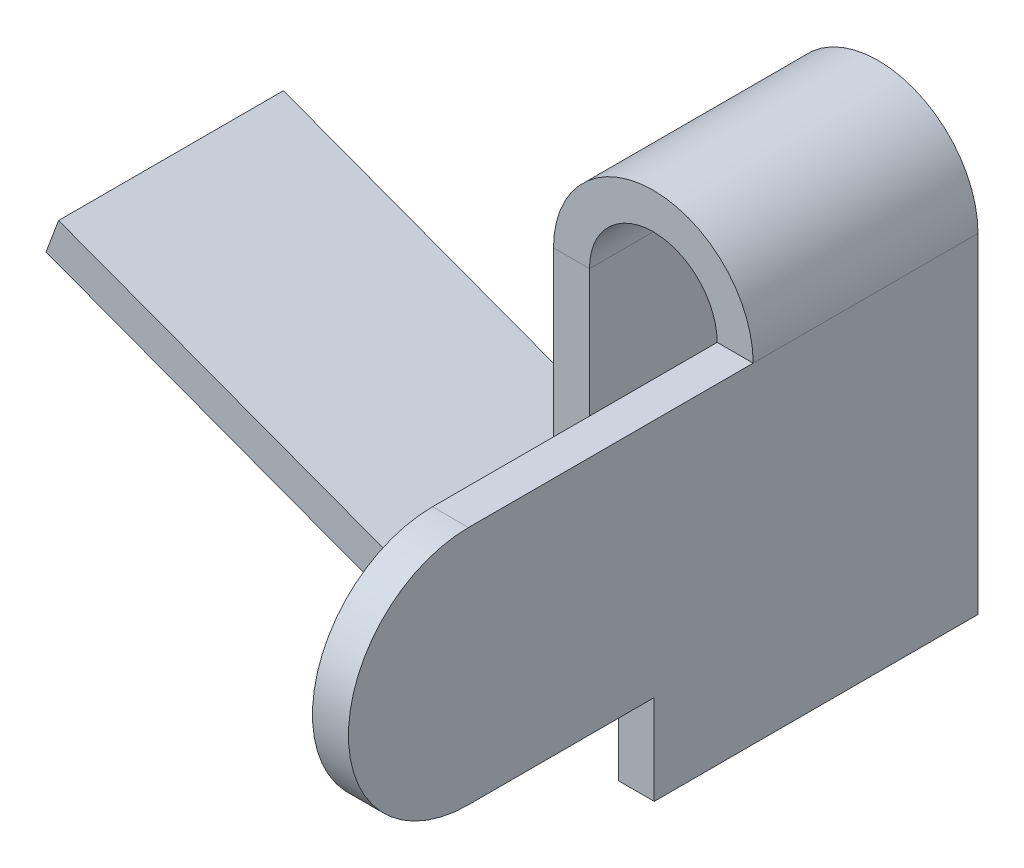
from build123d import *

# Parameters (mm, degrees)
BASE_FLANGE1_DEPTH  = 2.5
SKETCH8_W           = 0.4
SKETCH8_H           = 3.67
BOSS_EXTRUDE1_DEPTH = 4.5
SKETCH9_W           = 3.4
SKETCH9_H           = 1
CUT_EXTRUDE1_DEPTH  = 11.945052861
FILLET1_RADIUS      = 1.335
FILLET1_LENGTH      = 0.4


# Sheet-metal steps are written as plain solids
with BuildPart() as part:
    # Sketch3 → Base-Flange1 (new body)
    with BuildSketch(Plane.XY):
        with BuildLine():
            Line((0.71, -1.835), (0.71, 1.835))
            ThreePointArc((0.71, 1.835), (0, 2.545), (-0.71, 1.835))
            Line((-0.71, 1.835), (-0.71, -2.335))
            ThreePointArc((-0.71, -2.335), (-0.993802137, -2.877286979), (-1.601136872, -2.953203645))
            Line((-1.601136872, -2.953203645), (-6.752833912, -1.027063048))
            Line((-6.752833912, -1.027063048), (-6.61275096, -0.652394172))
            Line((-6.61275096, -0.652394172), (-1.461053919, -2.578534769))
            ThreePointArc((-1.461053919, -2.578534769), (-1.221800842, -2.548628204), (-1.11, -2.335))
            Line((-1.11, -2.335), (-1.11, 1.835))
            ThreePointArc((-1.11, 1.835), (0, 2.945), (1.11, 1.835))
            Line((1.11, 1.835), (1.11, -1.835))
            Line((1.11, -1.835), (0.71, -1.835))
        make_face()
    extrude(amount=BASE_FLANGE1_DEPTH)

    # Sketch8 → Boss-Extrude1 (add)
    with BuildSketch(Plane.XY.offset(2.5)):
        with Locations((0.91, 0)):
            Rectangle(SKETCH8_W, SKETCH8_H)
    extrude(amount=BOSS_EXTRUDE1_DEPTH)

    # Sketch9 → Cut-Extrude1 (cut, through all)
    with BuildSketch(Plane(origin=(1.11, 0, 0), x_dir=(0, 0, -1), z_dir=(1, 0, 0))):
        with Locations((-5.3, -1.335)):
            Rectangle(SKETCH9_W, SKETCH9_H)
    extrude(amount=-CUT_EXTRUDE1_DEPTH, mode=Mode.SUBTRACT)

    # Fillet1: full round fillet: the end face becomes a half cylinder, R = half its width
    fillet1_face = Plane((0.91, 0.5, 7), x_dir=(-1, 0, 0), z_dir=(0, 0, 1))  # on the end face: x along it, z out of the body
    fillet1_slab = fillet1_face.offset(-FILLET1_RADIUS / 2) * Box(FILLET1_LENGTH, 2 * FILLET1_RADIUS, FILLET1_RADIUS, mode=Mode.PRIVATE)  # the body's end, R deep
    fillet1_round = Plane((0.91, 0.5, 5.665), x_dir=(0, 0, 1), z_dir=(-1, 0, 0)) * Cylinder(FILLET1_RADIUS, FILLET1_LENGTH, mode=Mode.PRIVATE)  # its axis R under the face
    add(fillet1_slab - fillet1_round, mode=Mode.SUBTRACT)


solid = part.part
